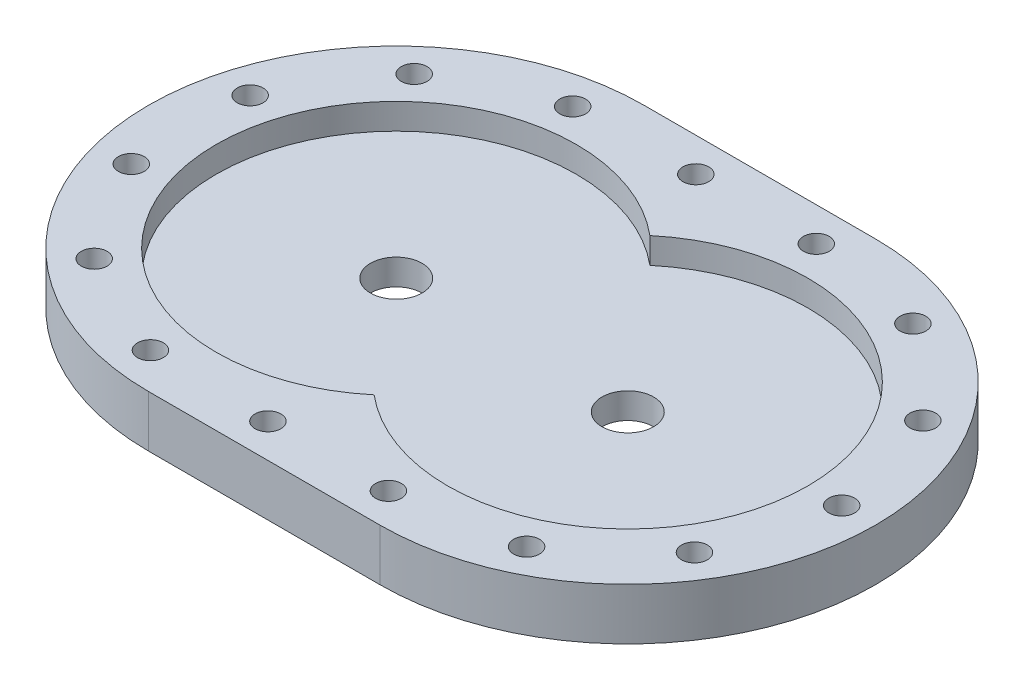
from build123d import *

# Parameters (mm, degrees)
SKETCH1_R             = 5
SKETCH1_R_2           = 10
BOSS_EXTRUDE1_DEPTH   = 10
SKETCH1_3_R           = 10
CUT_EXTRUDE1_DEPTH    = 10
SKETCH2_R             = 5
CUT_EXTRUDE2_DEPTH    = 172.619678432
CRVPATTERN1_START     = -10
CRVPATTERN1_OUTLINE_R = 5
CRVPATTERN1_DEPTH     = 20


# Read off the part's stored shape, not the designer's step: CrvPattern1
with BuildPart() as part:
    # Sketch1 → Boss-Extrude1 (new, symmetric)
    # profile 1 of 3: a face of its own
    with BuildSketch(Plane(origin=(0, 0, 0), x_dir=(1, 0, 0), z_dir=(0, 1, 0))):
        with BuildLine():
            ThreePointArc((-44.845, -96), (-140.845, 0), (-44.845, 96))
            Line((-44.845, 96), (44.845, 96))
            ThreePointArc((44.845, 96), (140.845, 0), (44.845, -96))
            Line((44.845, -96), (-44.845, -96))
        make_face()
        with Locations((127.72, 0)):
            Circle(SKETCH1_R, mode=Mode.SUBTRACT)
        with BuildLine():
            ThreePointArc((0, -53.422733691), (114.595, 0), (0, 53.422733691))
            ThreePointArc((0, 53.422733691), (-114.595, 0), (0, -53.422733691))
        make_face(mode=Mode.SUBTRACT)
    # profile 2 of 3: a face of its own
    with BuildSketch(Plane(origin=(0, 0, 0), x_dir=(1, 0, 0), z_dir=(0, 1, 0))):
        with Locations((127.72, 0)):
            Circle(SKETCH1_R)
    # profile 3 of 3: a face of its own
    with BuildSketch(Plane(origin=(0, 0, 0), x_dir=(1, 0, 0), z_dir=(0, 1, 0))):
        with BuildLine():
            ThreePointArc((0, 53.422733691), (-114.595, 0), (0, -53.422733691))
            ThreePointArc((0, -53.422733691), (114.595, 0), (0, 53.422733691))
        make_face()
        with Locations(Location((44.845, 0, 0), (0, 0, 270))):
            Circle(SKETCH1_R_2, mode=Mode.SUBTRACT)
        with Locations(Location((-44.845, 0, 0), (0, 0, 270))):
            Circle(SKETCH1_R_2, mode=Mode.SUBTRACT)
    extrude(amount=BOSS_EXTRUDE1_DEPTH, both=True)

    # Sketch1<3> → Cut-Extrude1 (cut)
    with BuildSketch(Plane(origin=(0, 0, 0), x_dir=(1, 0, 0), z_dir=(0, 1, 0))):
        with BuildLine():
            ThreePointArc((0, 53.422733691), (-114.595, 0), (0, -53.422733691))
            ThreePointArc((0, -53.422733691), (114.595, 0), (0, 53.422733691))
        make_face()
        with Locations(Location((44.845, 0, 0), (0, 0, 270))):
            Circle(SKETCH1_3_R, mode=Mode.SUBTRACT)
        with Locations(Location((-44.845, 0, 0), (0, 0, 270))):
            Circle(SKETCH1_3_R, mode=Mode.SUBTRACT)
    extrude(amount=CUT_EXTRUDE1_DEPTH, mode=Mode.SUBTRACT)

    # Sketch2 → Cut-Extrude2 (cut, through all)
    with BuildSketch(Plane(origin=(0, 10, 0), x_dir=(1, 0, 0), z_dir=(0, 1, 0))):
        with Locations(Location((127.72, 0, 0), (0, 0, 270))):
            Circle(SKETCH2_R)
    extrude(amount=-CUT_EXTRUDE2_DEPTH, mode=Mode.SUBTRACT)

    # CrvPattern1 outline → CrvPattern1 (cut)
    with BuildSketch(Plane(origin=(0, 0, 0), x_dir=(1, 0, 0), z_dir=(0, 1, 0)).offset(CRVPATTERN1_START)):
        with Locations((114.921070285, -44.244886692)):
            Circle(CRVPATTERN1_OUTLINE_R)
        with Locations((114.921070285, 44.244886692)):
            Circle(CRVPATTERN1_OUTLINE_R)
        with Locations((80.477526434, 74.823717396)):
            Circle(CRVPATTERN1_OUTLINE_R)
        with Locations((35.004949117, 82.875)):
            Circle(CRVPATTERN1_OUTLINE_R)
        with Locations((-11.668316372, 82.875)):
            Circle(CRVPATTERN1_OUTLINE_R)
        with Locations((-58.282002325, 81.778435993)):
            Circle(CRVPATTERN1_OUTLINE_R)
        with Locations((-99.866296576, 61.97517687)):
            Circle(CRVPATTERN1_OUTLINE_R)
        with Locations((-124.455991546, 23.029451797)):
            Circle(CRVPATTERN1_OUTLINE_R)
        with Locations((-124.455991546, -23.029451797)):
            Circle(CRVPATTERN1_OUTLINE_R)
        with Locations((-99.866296576, -61.97517687)):
            Circle(CRVPATTERN1_OUTLINE_R)
        with Locations((-58.282002325, -81.778435993)):
            Circle(CRVPATTERN1_OUTLINE_R)
        with Locations((-11.668316372, -82.875)):
            Circle(CRVPATTERN1_OUTLINE_R)
        with Locations((35.004949117, -82.875)):
            Circle(CRVPATTERN1_OUTLINE_R)
        with Locations((80.477526434, -74.823717396)):
            Circle(CRVPATTERN1_OUTLINE_R)
    extrude(amount=CRVPATTERN1_DEPTH, mode=Mode.SUBTRACT)


solid = part.part
